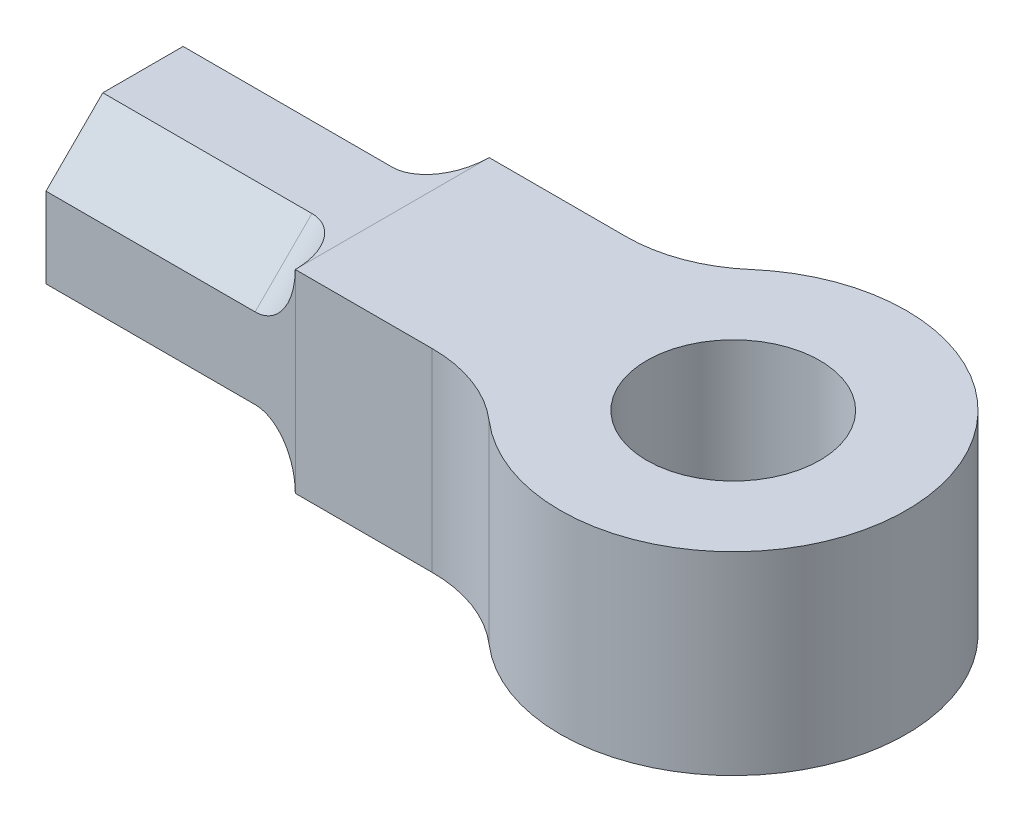
from build123d import *

# Parameters (mm, degrees)
CROQUIS1_R              = 12.5
SALIENTE_EXTRUIR1_DEPTH = 14
SALIENTE_EXTRUIR2_DEPTH = 36
REDONDEO1_R             = 5.8
REDONDEO2_R             = 20


with BuildPart() as part:
    # Croquis1 → Saliente-Extruir1 (new, symmetric)
    with BuildSketch(Plane(origin=(0, 0, 0), x_dir=(1, 0, 0), z_dir=(0, 1, 0))):
        with BuildLine():
            Line((-20.712315177, 14), (-49.257403189, 14))
            Line((-49.257403189, 14), (-49.257403189, -14))
            Line((-49.257403189, -14), (-20.712315177, -14))
            ThreePointArc((-20.712315177, -14), (25, 0), (-20.712315177, 14))
        make_face()
        with Locations(Location((0, 0, 0), (0, 0, 270))):
            Circle(CROQUIS1_R, mode=Mode.SUBTRACT)
    extrude(amount=SALIENTE_EXTRUIR1_DEPTH, both=True)

    # Croquis2 → Saliente-Extruir2 (add)
    with BuildSketch(Plane.ZY.offset(49.257403189)):
        Polygon((5.800067886, 14.002602553), (-5.800067886, 14.002602553), (-14.002602553, 5.800067886), (-14.002602553, -5.800067886), (-5.800067886, -14.002602553), (5.800067886, -14.002602553), (14.002602553, -5.800067886), (14.002602553, 5.800067886), align=None)
    extrude(amount=SALIENTE_EXTRUIR2_DEPTH)

    # Redondeo1
    # the kernel refuses this fillet: 5.8 mm, written as the material it adds along each edge
    with BuildSketch(Plane(origin=(-49.257403189, 4.450377888, -24.253048327), x_dir=(-1.2250736823450002e-15, -0.7071067811865477, -0.7071067811865472), z_dir=(0, -0.7071067811865472, 0.7071067811865478))) as redondeo1_piece_1_section:
        with BuildLine():
            CenterArc((REDONDEO1_R, -REDONDEO1_R), REDONDEO1_R, 90, 90)
            Line((0, -REDONDEO1_R), (0, 0))
            Line((0, 0), (REDONDEO1_R, 0))
        make_face()
    redondeo1_piece_1 = extrude(amount=40.59277464, mode=Mode.PRIVATE)
    redondeo1_piece_1 = split(redondeo1_piece_1, bisect_by=Plane(origin=(-50.689719309, -7.470344952, -14), z_dir=(0, 0, -1)), keep=Keep.TOP, mode=Mode.PRIVATE)
    redondeo1_piece_1 = split(redondeo1_piece_1, bisect_by=Plane(origin=(-50.689719309, -14, -14.001301277), z_dir=(0, 1, 0)), keep=Keep.TOP, mode=Mode.PRIVATE)
    redondeo1_piece_1 = split(redondeo1_piece_1, bisect_by=Plane(origin=(-49.257403189, -7.470344952, -14.001301277), z_dir=(-1, 0, 0)), keep=Keep.TOP, mode=Mode.PRIVATE)
    redondeo1_piece_1 = split(redondeo1_piece_1, bisect_by=Plane(origin=(-50.689719309, -7.470344952, -14.002602553), z_dir=(0, 0, 1)), keep=Keep.TOP, mode=Mode.PRIVATE)
    add(redondeo1_piece_1)
    with BuildSketch(Plane(origin=(-49.257403189, 4.450377888, -24.253048327), x_dir=(-1.2250736823450002e-15, -0.7071067811865477, -0.7071067811865472), z_dir=(0, -0.7071067811865472, 0.7071067811865478))) as redondeo1_piece_2_section:
        with BuildLine():
            CenterArc((REDONDEO1_R, -REDONDEO1_R), REDONDEO1_R, 90, 90)
            Line((0, -REDONDEO1_R), (0, 0))
            Line((0, 0), (REDONDEO1_R, 0))
        make_face()
    redondeo1_piece_2 = extrude(amount=40.59277464, mode=Mode.PRIVATE)
    redondeo1_piece_2 = split(redondeo1_piece_2, bisect_by=Plane(origin=(-50.864282471, -10.548199543, -14), z_dir=(0, 0, 1)), keep=Keep.TOP, mode=Mode.PRIVATE)
    redondeo1_piece_2 = split(redondeo1_piece_2, bisect_by=Plane(origin=(-50.864282471, -14, -10.548199543), z_dir=(0, 1, 0)), keep=Keep.TOP, mode=Mode.PRIVATE)
    redondeo1_piece_2 = split(redondeo1_piece_2, bisect_by=Plane(origin=(-49.257403189, -10.548199543, -10.548199543), z_dir=(-1, 0, 0)), keep=Keep.TOP, mode=Mode.PRIVATE)
    add(redondeo1_piece_2)
    with BuildSketch(Plane(origin=(-49.257403189, 4.450377888, -24.253048327), x_dir=(-1.2250736823450002e-15, -0.7071067811865477, -0.7071067811865472), z_dir=(0, -0.7071067811865472, 0.7071067811865478))) as redondeo1_piece_3_section:
        with BuildLine():
            CenterArc((REDONDEO1_R, -REDONDEO1_R), REDONDEO1_R, 90, 90)
            Line((0, -REDONDEO1_R), (0, 0))
            Line((0, 0), (REDONDEO1_R, 0))
        make_face()
    redondeo1_piece_3 = extrude(amount=40.59277464, mode=Mode.PRIVATE)
    redondeo1_piece_3 = split(redondeo1_piece_3, bisect_by=Plane(origin=(-50.68971928, -14.001301277, -14), z_dir=(0, 0, 1)), keep=Keep.TOP, mode=Mode.PRIVATE)
    redondeo1_piece_3 = split(redondeo1_piece_3, bisect_by=Plane(origin=(-50.68971928, -14, -7.470345028), z_dir=(0, -1, 0)), keep=Keep.TOP, mode=Mode.PRIVATE)
    redondeo1_piece_3 = split(redondeo1_piece_3, bisect_by=Plane(origin=(-49.257403189, -14.001301277, -7.470345028), z_dir=(-1, 0, 0)), keep=Keep.TOP, mode=Mode.PRIVATE)
    redondeo1_piece_3 = split(redondeo1_piece_3, bisect_by=Plane(origin=(-50.68971928, -14.002602553, -7.470345028), z_dir=(0, 1, 0)), keep=Keep.TOP, mode=Mode.PRIVATE)
    add(redondeo1_piece_3)
    with BuildSketch(Plane(origin=(-49.257403189, -24.253048327, -4.450377888), x_dir=(0, -0.7071067811865475, 0.7071067811865475), z_dir=(0, 0.7071067811865476, 0.7071067811865475))) as redondeo1_piece_4_section:
        with BuildLine():
            CenterArc((REDONDEO1_R, -REDONDEO1_R), REDONDEO1_R, 90, 90)
            Line((0, -REDONDEO1_R), (0, 0))
            Line((0, 0), (REDONDEO1_R, 0))
        make_face()
    redondeo1_piece_4 = extrude(amount=40.59277464, mode=Mode.PRIVATE)
    redondeo1_piece_4 = split(redondeo1_piece_4, bisect_by=Plane(origin=(-50.68971931, -14, 7.470344956), z_dir=(0, -1, 0)), keep=Keep.TOP, mode=Mode.PRIVATE)
    redondeo1_piece_4 = split(redondeo1_piece_4, bisect_by=Plane(origin=(-49.257403189, -14.001301277, 7.470344956), z_dir=(-1, 0, 0)), keep=Keep.TOP, mode=Mode.PRIVATE)
    redondeo1_piece_4 = split(redondeo1_piece_4, bisect_by=Plane(origin=(-50.68971931, -14.001301277, 14), z_dir=(0, 0, -1)), keep=Keep.TOP, mode=Mode.PRIVATE)
    redondeo1_piece_4 = split(redondeo1_piece_4, bisect_by=Plane(origin=(-50.68971931, -14.002602553, 7.470344956), z_dir=(0, 1, 0)), keep=Keep.TOP, mode=Mode.PRIVATE)
    add(redondeo1_piece_4)
    with BuildSketch(Plane(origin=(-49.257403189, -24.253048327, -4.450377888), x_dir=(0, -0.7071067811865475, 0.7071067811865475), z_dir=(0, 0.7071067811865476, 0.7071067811865475))) as redondeo1_piece_5_section:
        with BuildLine():
            CenterArc((REDONDEO1_R, -REDONDEO1_R), REDONDEO1_R, 90, 90)
            Line((0, -REDONDEO1_R), (0, 0))
            Line((0, 0), (REDONDEO1_R, 0))
        make_face()
    redondeo1_piece_5 = extrude(amount=40.59277464, mode=Mode.PRIVATE)
    redondeo1_piece_5 = split(redondeo1_piece_5, bisect_by=Plane(origin=(-50.864282471, -14, 10.548199543), z_dir=(0, 1, 0)), keep=Keep.TOP, mode=Mode.PRIVATE)
    redondeo1_piece_5 = split(redondeo1_piece_5, bisect_by=Plane(origin=(-49.257403189, -10.548199543, 10.548199543), z_dir=(-1, 0, 0)), keep=Keep.TOP, mode=Mode.PRIVATE)
    redondeo1_piece_5 = split(redondeo1_piece_5, bisect_by=Plane(origin=(-50.864282471, -10.548199543, 14), z_dir=(0, 0, -1)), keep=Keep.TOP, mode=Mode.PRIVATE)
    add(redondeo1_piece_5)
    with BuildSketch(Plane(origin=(-49.257403189, -24.253048327, -4.450377888), x_dir=(0, -0.7071067811865475, 0.7071067811865475), z_dir=(0, 0.7071067811865476, 0.7071067811865475))) as redondeo1_piece_6_section:
        with BuildLine():
            CenterArc((REDONDEO1_R, -REDONDEO1_R), REDONDEO1_R, 90, 90)
            Line((0, -REDONDEO1_R), (0, 0))
            Line((0, 0), (REDONDEO1_R, 0))
        make_face()
    redondeo1_piece_6 = extrude(amount=40.59277464, mode=Mode.PRIVATE)
    redondeo1_piece_6 = split(redondeo1_piece_6, bisect_by=Plane(origin=(-50.689719279, -14, 14.001301277), z_dir=(0, 1, 0)), keep=Keep.TOP, mode=Mode.PRIVATE)
    redondeo1_piece_6 = split(redondeo1_piece_6, bisect_by=Plane(origin=(-49.257403189, -7.470345026, 14.001301277), z_dir=(-1, 0, 0)), keep=Keep.TOP, mode=Mode.PRIVATE)
    redondeo1_piece_6 = split(redondeo1_piece_6, bisect_by=Plane(origin=(-50.689719279, -7.470345026, 14), z_dir=(0, 0, 1)), keep=Keep.TOP, mode=Mode.PRIVATE)
    redondeo1_piece_6 = split(redondeo1_piece_6, bisect_by=Plane(origin=(-50.689719279, -7.470345026, 14.002602553), z_dir=(0, 0, -1)), keep=Keep.TOP, mode=Mode.PRIVATE)
    add(redondeo1_piece_6)
    with BuildSketch(Plane(origin=(-49.257403189, 24.253048327, 4.450377888), x_dir=(0, 0.7071067811865474, -0.7071067811865477), z_dir=(0, -0.7071067811865478, -0.7071067811865474))) as redondeo1_piece_7_section:
        with BuildLine():
            CenterArc((REDONDEO1_R, -REDONDEO1_R), REDONDEO1_R, 90, 90)
            Line((0, -REDONDEO1_R), (0, 0))
            Line((0, 0), (REDONDEO1_R, 0))
        make_face()
    redondeo1_piece_7 = extrude(amount=40.59277464, mode=Mode.PRIVATE)
    redondeo1_piece_7 = split(redondeo1_piece_7, bisect_by=Plane(origin=(-50.689719309, 14.001301277, -14), z_dir=(0, 0, 1)), keep=Keep.TOP, mode=Mode.PRIVATE)
    redondeo1_piece_7 = split(redondeo1_piece_7, bisect_by=Plane(origin=(-49.257403189, 14.001301277, -7.470344953), z_dir=(-1, 0, 0)), keep=Keep.TOP, mode=Mode.PRIVATE)
    redondeo1_piece_7 = split(redondeo1_piece_7, bisect_by=Plane(origin=(-50.689719309, 14, -7.470344953), z_dir=(0, 1, 0)), keep=Keep.TOP, mode=Mode.PRIVATE)
    redondeo1_piece_7 = split(redondeo1_piece_7, bisect_by=Plane(origin=(-50.689719309, 14.002602553, -7.470344953), z_dir=(0, -1, 0)), keep=Keep.TOP, mode=Mode.PRIVATE)
    add(redondeo1_piece_7)
    with BuildSketch(Plane(origin=(-49.257403189, 24.253048327, 4.450377888), x_dir=(0, 0.7071067811865474, -0.7071067811865477), z_dir=(0, -0.7071067811865478, -0.7071067811865474))) as redondeo1_piece_8_section:
        with BuildLine():
            CenterArc((REDONDEO1_R, -REDONDEO1_R), REDONDEO1_R, 90, 90)
            Line((0, -REDONDEO1_R), (0, 0))
            Line((0, 0), (REDONDEO1_R, 0))
        make_face()
    redondeo1_piece_8 = extrude(amount=40.59277464, mode=Mode.PRIVATE)
    redondeo1_piece_8 = split(redondeo1_piece_8, bisect_by=Plane(origin=(-50.864282471, 10.548199543, -14), z_dir=(0, 0, 1)), keep=Keep.TOP, mode=Mode.PRIVATE)
    redondeo1_piece_8 = split(redondeo1_piece_8, bisect_by=Plane(origin=(-49.257403189, 10.548199543, -10.548199543), z_dir=(-1, 0, 0)), keep=Keep.TOP, mode=Mode.PRIVATE)
    redondeo1_piece_8 = split(redondeo1_piece_8, bisect_by=Plane(origin=(-50.864282471, 14, -10.548199543), z_dir=(0, -1, 0)), keep=Keep.TOP, mode=Mode.PRIVATE)
    add(redondeo1_piece_8)
    with BuildSketch(Plane(origin=(-49.257403189, 24.253048327, 4.450377888), x_dir=(0, 0.7071067811865474, -0.7071067811865477), z_dir=(0, -0.7071067811865478, -0.7071067811865474))) as redondeo1_piece_9_section:
        with BuildLine():
            CenterArc((REDONDEO1_R, -REDONDEO1_R), REDONDEO1_R, 90, 90)
            Line((0, -REDONDEO1_R), (0, 0))
            Line((0, 0), (REDONDEO1_R, 0))
        make_face()
    redondeo1_piece_9 = extrude(amount=40.59277464, mode=Mode.PRIVATE)
    redondeo1_piece_9 = split(redondeo1_piece_9, bisect_by=Plane(origin=(-50.689719282, 7.470345028, -14), z_dir=(0, 0, -1)), keep=Keep.TOP, mode=Mode.PRIVATE)
    redondeo1_piece_9 = split(redondeo1_piece_9, bisect_by=Plane(origin=(-49.257403189, 7.470345028, -14.001301277), z_dir=(-1, 0, 0)), keep=Keep.TOP, mode=Mode.PRIVATE)
    redondeo1_piece_9 = split(redondeo1_piece_9, bisect_by=Plane(origin=(-50.689719282, 14, -14.001301277), z_dir=(0, -1, 0)), keep=Keep.TOP, mode=Mode.PRIVATE)
    redondeo1_piece_9 = split(redondeo1_piece_9, bisect_by=Plane(origin=(-50.689719282, 7.470345028, -14.002602553), z_dir=(0, 0, 1)), keep=Keep.TOP, mode=Mode.PRIVATE)
    add(redondeo1_piece_9)
    with BuildSketch(Plane(origin=(-49.257403189, -4.450377888, 24.253048327), x_dir=(1.2250736823450004e-15, 0.7071067811865477, 0.7071067811865474), z_dir=(0, 0.7071067811865474, -0.7071067811865478))) as redondeo1_piece_10_section:
        with BuildLine():
            CenterArc((REDONDEO1_R, -REDONDEO1_R), REDONDEO1_R, 90, 90)
            Line((0, -REDONDEO1_R), (0, 0))
            Line((0, 0), (REDONDEO1_R, 0))
        make_face()
    redondeo1_piece_10 = extrude(amount=40.59277464, mode=Mode.PRIVATE)
    redondeo1_piece_10 = split(redondeo1_piece_10, bisect_by=Plane(origin=(-50.68971931, 14, 14.001301277), z_dir=(0, -1, 0)), keep=Keep.TOP, mode=Mode.PRIVATE)
    redondeo1_piece_10 = split(redondeo1_piece_10, bisect_by=Plane(origin=(-50.68971931, 7.470344952, 14), z_dir=(0, 0, 1)), keep=Keep.TOP, mode=Mode.PRIVATE)
    redondeo1_piece_10 = split(redondeo1_piece_10, bisect_by=Plane(origin=(-49.257403189, 7.470344952, 14.001301277), z_dir=(-1, 0, 0)), keep=Keep.TOP, mode=Mode.PRIVATE)
    redondeo1_piece_10 = split(redondeo1_piece_10, bisect_by=Plane(origin=(-50.68971931, 7.470344952, 14.002602553), z_dir=(0, 0, -1)), keep=Keep.TOP, mode=Mode.PRIVATE)
    add(redondeo1_piece_10)
    with BuildSketch(Plane(origin=(-49.257403189, -4.450377888, 24.253048327), x_dir=(1.2250736823450004e-15, 0.7071067811865477, 0.7071067811865474), z_dir=(0, 0.7071067811865474, -0.7071067811865478))) as redondeo1_piece_11_section:
        with BuildLine():
            CenterArc((REDONDEO1_R, -REDONDEO1_R), REDONDEO1_R, 90, 90)
            Line((0, -REDONDEO1_R), (0, 0))
            Line((0, 0), (REDONDEO1_R, 0))
        make_face()
    redondeo1_piece_11 = extrude(amount=40.59277464, mode=Mode.PRIVATE)
    redondeo1_piece_11 = split(redondeo1_piece_11, bisect_by=Plane(origin=(-50.864282471, 14, 10.548199543), z_dir=(0, -1, 0)), keep=Keep.TOP, mode=Mode.PRIVATE)
    redondeo1_piece_11 = split(redondeo1_piece_11, bisect_by=Plane(origin=(-50.864282471, 10.548199543, 14), z_dir=(0, 0, -1)), keep=Keep.TOP, mode=Mode.PRIVATE)
    redondeo1_piece_11 = split(redondeo1_piece_11, bisect_by=Plane(origin=(-49.257403189, 10.548199543, 10.548199543), z_dir=(-1, 0, 0)), keep=Keep.TOP, mode=Mode.PRIVATE)
    add(redondeo1_piece_11)
    with BuildSketch(Plane(origin=(-49.257403189, -4.450377888, 24.253048327), x_dir=(1.2250736823450004e-15, 0.7071067811865477, 0.7071067811865474), z_dir=(0, 0.7071067811865474, -0.7071067811865478))) as redondeo1_piece_12_section:
        with BuildLine():
            CenterArc((REDONDEO1_R, -REDONDEO1_R), REDONDEO1_R, 90, 90)
            Line((0, -REDONDEO1_R), (0, 0))
            Line((0, 0), (REDONDEO1_R, 0))
        make_face()
    redondeo1_piece_12 = extrude(amount=40.59277464, mode=Mode.PRIVATE)
    redondeo1_piece_12 = split(redondeo1_piece_12, bisect_by=Plane(origin=(-50.689719281, 14, 7.47034503), z_dir=(0, 1, 0)), keep=Keep.TOP, mode=Mode.PRIVATE)
    redondeo1_piece_12 = split(redondeo1_piece_12, bisect_by=Plane(origin=(-50.689719281, 14.001301277, 14), z_dir=(0, 0, -1)), keep=Keep.TOP, mode=Mode.PRIVATE)
    redondeo1_piece_12 = split(redondeo1_piece_12, bisect_by=Plane(origin=(-49.257403189, 14.001301277, 7.47034503), z_dir=(-1, 0, 0)), keep=Keep.TOP, mode=Mode.PRIVATE)
    redondeo1_piece_12 = split(redondeo1_piece_12, bisect_by=Plane(origin=(-50.689719281, 14.002602553, 7.47034503), z_dir=(0, -1, 0)), keep=Keep.TOP, mode=Mode.PRIVATE)
    add(redondeo1_piece_12)

    # Redondeo2
    redondeo2_edges = [part.edges().sort_by_distance(p)[0] for p in [
        (-20.712315177, 0, -14),
        (-20.712315177, 0, 14),
    ]]
    fillet(redondeo2_edges, radius=REDONDEO2_R)


solid = part.part
